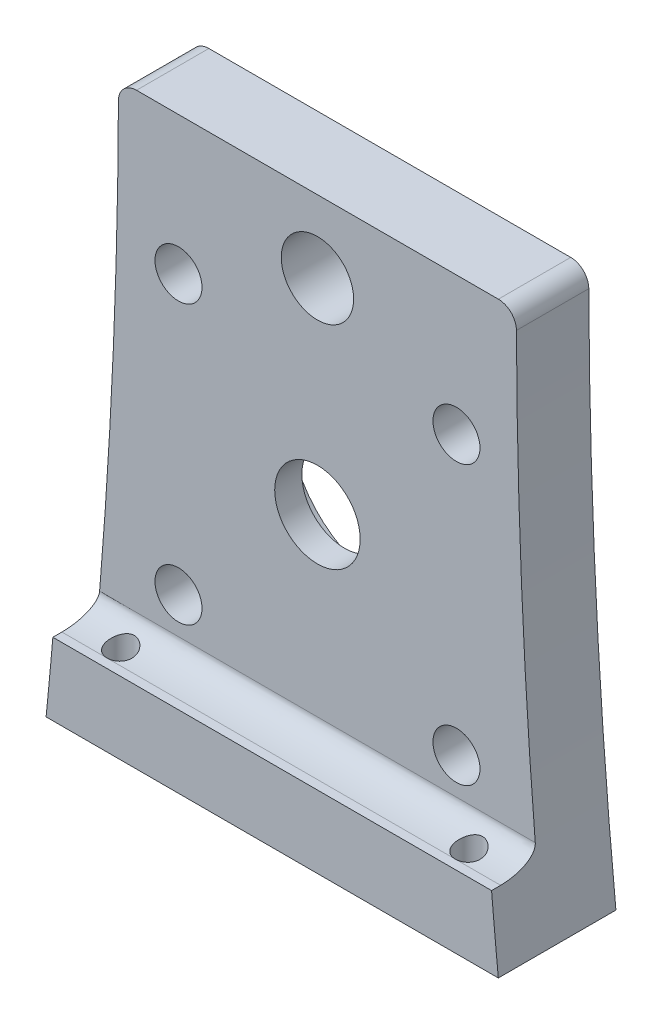
from build123d import *

# Parameters (mm, degrees)
BOSS_EXTRUDE1_DEPTH  = 8
BOSS_EXTRUDE2_DEPTH  = 5
SKETCH3_R            = 1.5
CUT_EXTRUDE_DEPTH    = 8
FILLET1_SIZE         = 2
FILLET1_SIZE_2       = 4
FILLET2_R            = 2
SKETCH4_R            = 4.0005
SKETCH4_R_2          = 4.725
M4_H6_T_INSERT_DEPTH = 8
SKETCH13_R           = 11.176
CUT_EXTRUDE2_DEPTH   = 5
SKETCH14_R           = 2.6
CUT_EXTRUDE3_DEPTH   = 67.287253734


with BuildPart() as part:
    # Sketch1 → Boss-Extrude1 (new body)
    with BuildSketch(Plane.XY):
        with BuildLine():
            Line((22, 60), (-22, 60))
            ThreePointArc((-22, 60), (-22.750468165, 29.962523408), (-25, 0))
            Line((-25, 0), (25, 0))
            ThreePointArc((25, 0), (22.750468165, 29.962523408), (22, 60))
        make_face()
    extrude(amount=BOSS_EXTRUDE1_DEPTH)

    # Sketch2 → Boss-Extrude2 (add)
    with BuildSketch(Plane.XY.offset(8)):
        with BuildLine():
            Line((-25, 0), (25, 0))
            ThreePointArc((25, 0), (24.612606496, 3.998750886), (24.251929498, 8))
            Line((24.251929498, 8), (-24.251929498, 8))
            ThreePointArc((-24.251929498, 8), (-24.612606496, 3.998750886), (-25, 0))
        make_face()
    extrude(amount=BOSS_EXTRUDE2_DEPTH)

    # Sketch3 → Cut-Extrude (cut)
    with BuildSketch(Plane(origin=(0, 8, 0), x_dir=(1, 0, 0), z_dir=(0, 1, 0))):
        with Locations(Location((-19.251929498, -10.5, 0), (0, 0, 270))):
            Circle(SKETCH3_R)
        with Locations(Location((19.251929498, -10.5, 0), (0, 0, 270))):
            Circle(SKETCH3_R)
    extrude(amount=-CUT_EXTRUDE_DEPTH, mode=Mode.SUBTRACT)

    # Fillet1
    # an asymmetric fillet: 4, 2 mm, written as the material it adds along each edge
    with BuildSketch(Plane(origin=(34.251929498, 8, 8), x_dir=(0, 1, 0), z_dir=(-1, 0, 0))) as fillet1_piece_1_section:
        with BuildLine():
            Bezier((FILLET1_SIZE, 0), (0, 0), (0, -FILLET1_SIZE_2), weights=[1, 0.707106781, 1])
            Line((0, -FILLET1_SIZE_2), (-0.08, -4))
            Line((-0.08, -4), (-0.08, 0.08))
            Line((-0.08, 0.08), (2, 0.08))
            Line((2, 0.08), (FILLET1_SIZE, 0))
        make_face()
    fillet1_piece_1 = extrude(amount=68.503858997, mode=Mode.PRIVATE)
    fillet1_piece_1 = fillet1_piece_1 - Plane(origin=(-623.5, 60, 8.94437244), x_dir=(1, 0, 0), z_dir=(0, 0, -1)) * Cylinder(601.5, 154, mode=Mode.PRIVATE)
    fillet1_piece_1 = fillet1_piece_1 - Plane(origin=(623.5, 60, 8.94437244), x_dir=(-0.9950124688279272, -0.09975062344142714, 0), z_dir=(0, 0, -1)) * Cylinder(601.5, 154, mode=Mode.PRIVATE)
    fillet1_piece_1 = fillet1_piece_1 - Plane(origin=(-19.251929498, 8.425610742, 10.5), x_dir=(0, 0, 1), z_dir=(0, 1, 0)) * Cylinder(1.5, 154, mode=Mode.PRIVATE)
    fillet1_piece_1 = fillet1_piece_1 - Plane(origin=(19.251929498, 8.425610742, 10.5), x_dir=(0, 0, 1), z_dir=(0, 1, 0)) * Cylinder(1.5, 154, mode=Mode.PRIVATE)
    add(fillet1_piece_1)

    # Fillet2
    fillet2_edges = [part.edges().sort_by_distance(p)[0] for p in [
        (22, 60, 4),
        (-22, 60, 4),
    ]]
    fillet(fillet2_edges, radius=FILLET2_R)

    # Sketch4 → M4*H6 T-Insert (cut)
    with BuildSketch(Plane(origin=(0, 0, 0), x_dir=(-1, 0, 0), z_dir=(0, 0, -1))):
        with Locations((0, 52)):
            Circle(SKETCH4_R)
        with Locations((0, 29.37)):
            Circle(SKETCH4_R_2)
    extrude(amount=-M4_H6_T_INSERT_DEPTH, mode=Mode.SUBTRACT)

    # Sketch13 → Cut-Extrude2 (cut)
    with BuildSketch(Plane(origin=(0, 0, 0), x_dir=(-1, 0, 0), z_dir=(0, 0, -1))):
        with Locations((0, 29.37)):
            Circle(SKETCH13_R)
    extrude(amount=-CUT_EXTRUDE2_DEPTH, mode=Mode.SUBTRACT)

    # Sketch14 → Cut-Extrude3 (cut, through all)
    with BuildSketch(Plane(origin=(0, 0, 0), x_dir=(-1, 0, 0), z_dir=(0, 0, -1))):
        with Locations((15.364, 14.003)):
            Circle(SKETCH14_R)
        with Locations((15.364, 44.737)):
            Circle(SKETCH14_R)
        with Locations((-15.37, 44.737)):
            Circle(SKETCH14_R)
        with Locations((-15.37, 14.003)):
            Circle(SKETCH14_R)
    extrude(amount=-CUT_EXTRUDE3_DEPTH, mode=Mode.SUBTRACT)


solid = part.part
